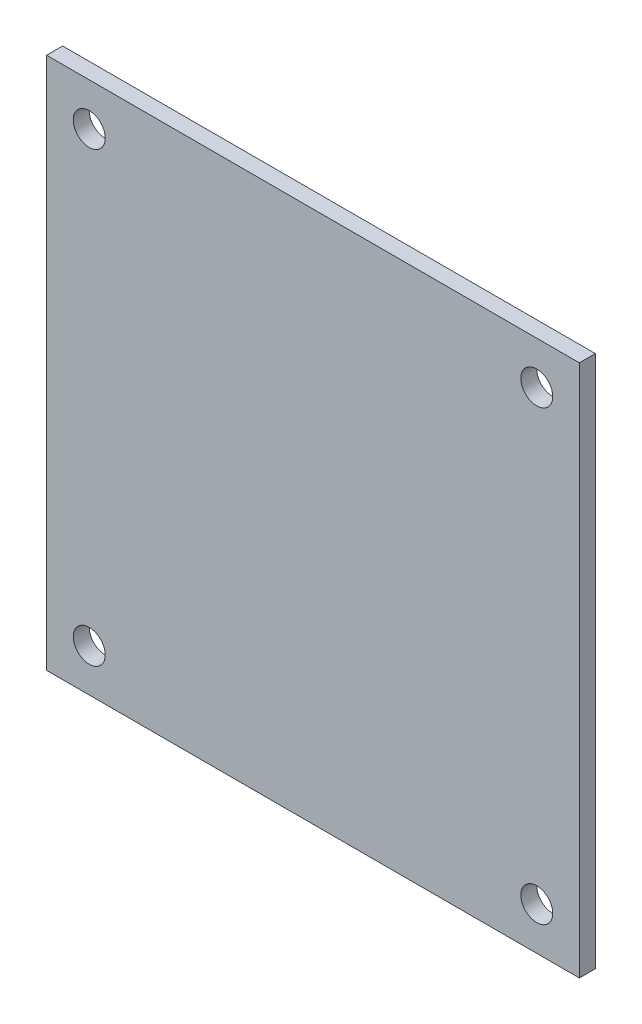
from build123d import *

# Parameters (mm, degrees)
ESQUISSE1_W        = 50
ESQUISSE1_H        = 50
BOSS_EXTRU_1_DEPTH = 1.5
PER_AGE1_OUTLINE_R = 1.5
PER_AGE1_DEPTH     = 1.5


# Read off the part's stored shape, not the designer's step: Perçage1
with BuildPart() as part:
    # Esquisse1 → Boss.-Extru.1 (new body)
    with BuildSketch(Plane.XY):
        with Locations((8.249655765, 8.889101498)):
            Rectangle(ESQUISSE1_W, ESQUISSE1_H)
    extrude(amount=BOSS_EXTRU_1_DEPTH)

    # Perçage1 outline → Perçage1 (cut)
    with BuildSketch(Plane.XY):
        with Locations((-12.750344235, -12.110898502)):
            Circle(PER_AGE1_OUTLINE_R)
        with Locations((-12.750344235, 29.889101498)):
            Circle(PER_AGE1_OUTLINE_R)
        with Locations((29.249655765, 29.889101498)):
            Circle(PER_AGE1_OUTLINE_R)
        with Locations((29.249655765, -12.110898502)):
            Circle(PER_AGE1_OUTLINE_R)
    extrude(amount=PER_AGE1_DEPTH, mode=Mode.SUBTRACT)


solid = part.part
